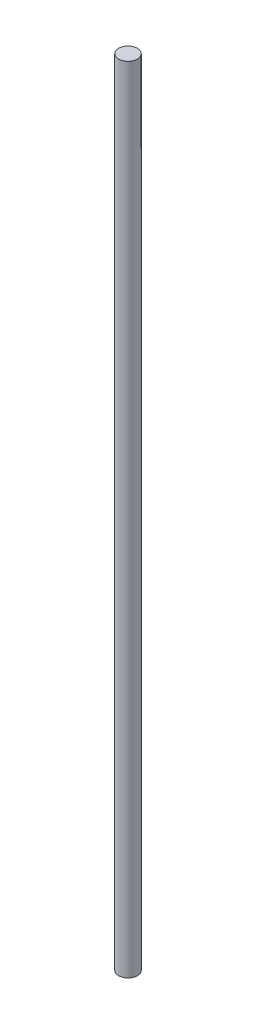
from build123d import *

# Parameters (mm, degrees)
SKETCH1_R           = 3
BOSS_EXTRUDE1_DEPTH = 254


with BuildPart() as part:
    # Sketch1 → Boss-Extrude1 (new body)
    with BuildSketch(Plane(origin=(0, 0, 0), x_dir=(1, 0, 0), z_dir=(0, 1, 0))):
        Circle(SKETCH1_R)
    extrude(amount=BOSS_EXTRUDE1_DEPTH)


solid = part.part
